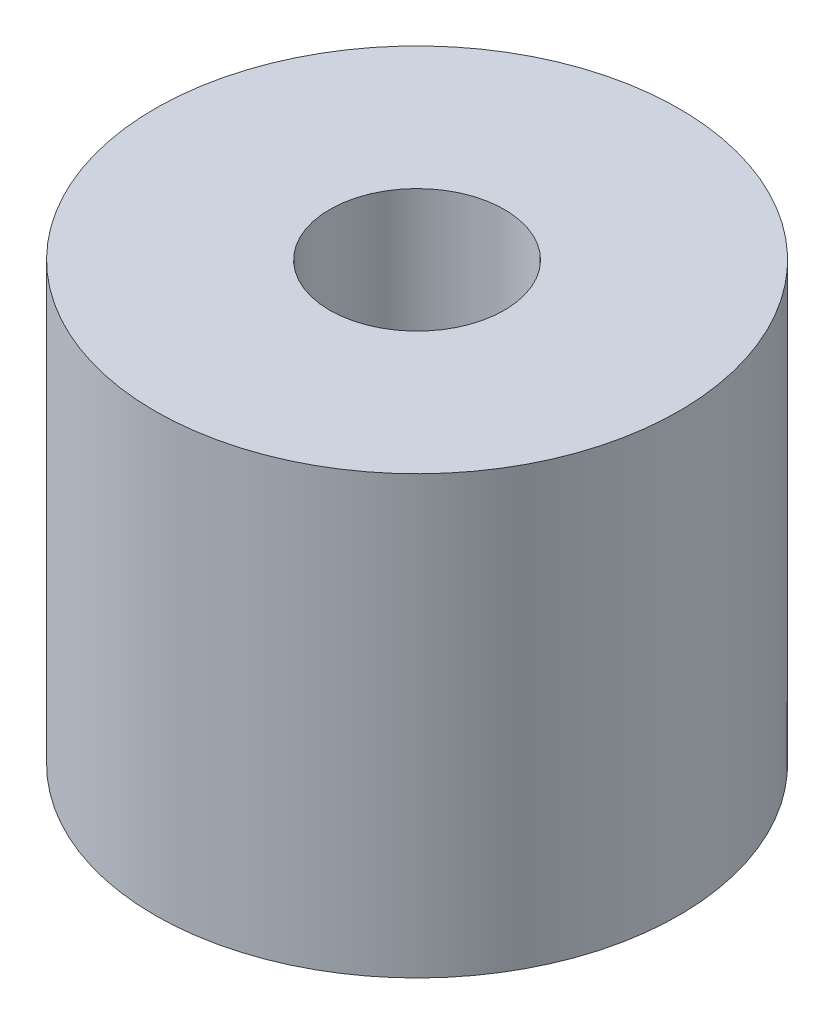
from build123d import *

# Parameters (mm, degrees)
SKETCH_1_R      = 15
SKETCH_1_R_2    = 5
EXTRUDE_1_DEPTH = 25


with BuildPart() as part:
    # Эскиз1 → Вытянуть1 (new body)
    with BuildSketch(Plane(origin=(0, 0, 0), x_dir=(1, 0, 0), z_dir=(0, 1, 0))):
        Circle(SKETCH_1_R)
        Circle(SKETCH_1_R_2, mode=Mode.SUBTRACT)
    extrude(amount=EXTRUDE_1_DEPTH)


solid = part.part
